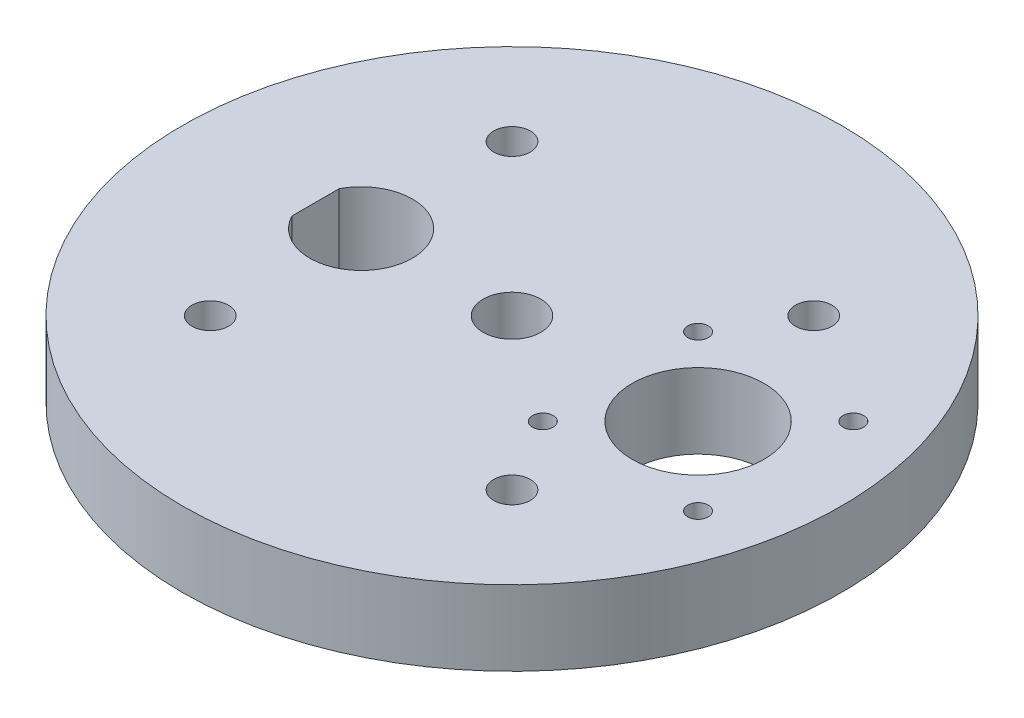
from build123d import *

# Parameters (mm, degrees)
SKETCH2_R           = 57.15
BOSS_EXTRUDE1_DEPTH = 13
CUT_EXTRUDE1_REACH  = 83.861
SKETCH6_R           = 3.175
SKETCH7_R           = 11.43
SKETCH7_R_2         = 1.778
CUT_EXTRUDE2_DEPTH  = 82.861132413
SKETCH8_R           = 5
CUT_EXTRUDE3_DEPTH  = 82.861132413


with BuildPart() as part:
    # Sketch2 → Boss-Extrude1 (new body)
    with BuildSketch(Plane(origin=(0, 0, 0), x_dir=(1, 0, 0), z_dir=(0, 1, 0))):
        Circle(SKETCH2_R)
    extrude(amount=BOSS_EXTRUDE1_DEPTH)

    # Sketch6 → Cut-Extrude1 (cut, up to next)
    with BuildSketch(Plane(origin=(0, 13, 0), x_dir=(1, 0, 0), z_dir=(0, 1, 0)), mode=Mode.PRIVATE) as cut_extrude1_sk1:
        with Locations((-26.1629, -26.1629)):
            Circle(SKETCH6_R)
    cut_extrude1_tool1 = extrude(cut_extrude1_sk1.sketch, amount=-CUT_EXTRUDE1_REACH, mode=Mode.PRIVATE) & part.part
    # Sketch6 → Cut-Extrude1 (cut, up to next)
    with BuildSketch(Plane(origin=(0, 13, 0), x_dir=(1, 0, 0), z_dir=(0, 1, 0)), mode=Mode.PRIVATE) as cut_extrude1_sk2:
        with Locations((26.1629, -26.1629)):
            Circle(SKETCH6_R)
    cut_extrude1_tool2 = extrude(cut_extrude1_sk2.sketch, amount=-CUT_EXTRUDE1_REACH, mode=Mode.PRIVATE) & part.part
    # Sketch6 → Cut-Extrude1 (cut, up to next)
    with BuildSketch(Plane(origin=(0, 13, 0), x_dir=(1, 0, 0), z_dir=(0, 1, 0)), mode=Mode.PRIVATE) as cut_extrude1_sk3:
        with Locations((-26.1629, 26.163103615)):
            Circle(SKETCH6_R)
    cut_extrude1_tool3 = extrude(cut_extrude1_sk3.sketch, amount=-CUT_EXTRUDE1_REACH, mode=Mode.PRIVATE) & part.part
    # Sketch6 → Cut-Extrude1 (cut, up to next)
    with BuildSketch(Plane(origin=(0, 13, 0), x_dir=(1, 0, 0), z_dir=(0, 1, 0)), mode=Mode.PRIVATE) as cut_extrude1_sk4:
        with Locations((26.1629, 26.163103615)):
            Circle(SKETCH6_R)
    cut_extrude1_tool4 = extrude(cut_extrude1_sk4.sketch, amount=-CUT_EXTRUDE1_REACH, mode=Mode.PRIVATE) & part.part
    add(cut_extrude1_tool1.solids().sort_by_distance((-26.1629, 13, 26.1629))[0], mode=Mode.SUBTRACT)
    add(cut_extrude1_tool2.solids().sort_by_distance((26.1629, 13, 26.1629))[0], mode=Mode.SUBTRACT)
    add(cut_extrude1_tool3.solids().sort_by_distance((-26.1629, 13, -26.163104))[0], mode=Mode.SUBTRACT)
    add(cut_extrude1_tool4.solids().sort_by_distance((26.1629, 13, -26.163104))[0], mode=Mode.SUBTRACT)

    # Sketch7 → Cut-Extrude2 (cut, through all)
    with BuildSketch(Plane(origin=(0, 13, 0), x_dir=(1, 0, 0), z_dir=(0, 1, 0))):
        with Locations((32, 0.269903496)):
            Circle(SKETCH7_R)
        with Locations((18.54, -13.194096504)):
            Circle(SKETCH7_R_2)
        with Locations((18.54, 13.729903496)):
            Circle(SKETCH7_R_2)
        with Locations((45.46, 13.729903496)):
            Circle(SKETCH7_R_2)
        with Locations((45.46, -13.194096504)):
            Circle(SKETCH7_R_2)
    extrude(amount=-CUT_EXTRUDE2_DEPTH, mode=Mode.SUBTRACT)

    # Sketch8 → Cut-Extrude3 (cut, through all)
    with BuildSketch(Plane(origin=(0, 13, 0), x_dir=(1, 0, 0), z_dir=(0, 1, 0))):
        Circle(SKETCH8_R)
        with BuildLine():
            Line((-34.0629, 4.098780306), (-34.0629, -4.098780306))
            ThreePointArc((-34.0629, -4.098780306), (-17.2629, 0), (-34.0629, 4.098780306))
        make_face()
    extrude(amount=-CUT_EXTRUDE3_DEPTH, mode=Mode.SUBTRACT)


solid = part.part
